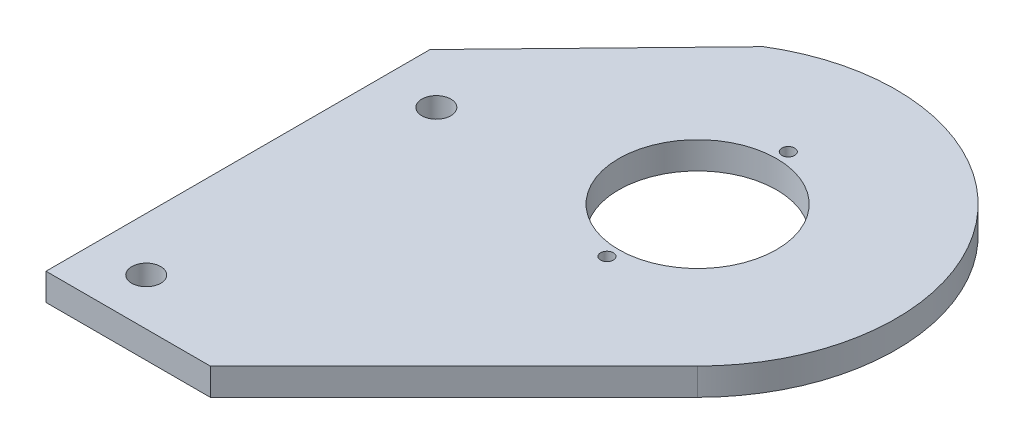
from build123d import *

# Parameters (mm, degrees)
BASE_FLANGE1_DEPTH = 6.35
SKETCH8_R          = 3.4
CUT_EXTRUDE1_DEPTH = 175.95180765
SKETCH9_R          = 18.5
CUT_EXTRUDE2_DEPTH = 175.95180765
SKETCH10_R         = 1.5
CUT_EXTRUDE3_DEPTH = 175.95180765


# Sheet-metal steps are written as plain solids
with BuildPart() as part:
    # Sketch2 → Base-Flange1 (new body)
    with BuildSketch(Plane(origin=(0, 0, 0), x_dir=(1, 0, 0), z_dir=(0, 1, 0))):
        with BuildLine():
            Line((0, 0), (38.51093065, 0))
            Line((38.51093065, 0), (95.630465325, 57.119534675))
            ThreePointArc((95.630465325, 57.119534675), (99.287953618, 118.761570635), (38.51093065, 129.682710556))
            Line((38.51093065, 129.682710556), (0, 90))
            Line((0, 90), (0, 0))
        make_face()
    extrude(amount=-BASE_FLANGE1_DEPTH)

    # Sketch8 → Cut-Extrude1 (cut, through all)
    with BuildSketch(Plane(origin=(0, 0, 0), x_dir=(1, 0, 0), z_dir=(0, 1, 0))):
        with Locations(Location((12.5, 79, 0), (0, 0, 270))):
            Circle(SKETCH8_R)
        with Locations(Location((12.5, 11, 0), (0, 0, 90))):
            Circle(SKETCH8_R)
    extrude(amount=-CUT_EXTRUDE1_DEPTH, mode=Mode.SUBTRACT)

    # Sketch9 → Cut-Extrude2 (cut, through all)
    with BuildSketch(Plane(origin=(0, 0, 0), x_dir=(1, 0, 0), z_dir=(0, 1, 0))):
        with Locations(Location((62.75, 90, 0), (0, 0, 270))):
            Circle(SKETCH9_R)
    extrude(amount=-CUT_EXTRUDE2_DEPTH, mode=Mode.SUBTRACT)

    # Sketch10 → Cut-Extrude3 (cut, through all)
    with BuildSketch(Plane(origin=(0, 0, 0), x_dir=(1, 0, 0), z_dir=(0, 1, 0))):
        with Locations(Location((62.75, 111.25, 0), (0, 0, 270))):
            Circle(SKETCH10_R)
        with Locations(Location((62.75, 68.75, 0), (0, 0, 270))):
            Circle(SKETCH10_R)
    extrude(amount=-CUT_EXTRUDE3_DEPTH, mode=Mode.SUBTRACT)


solid = part.part
